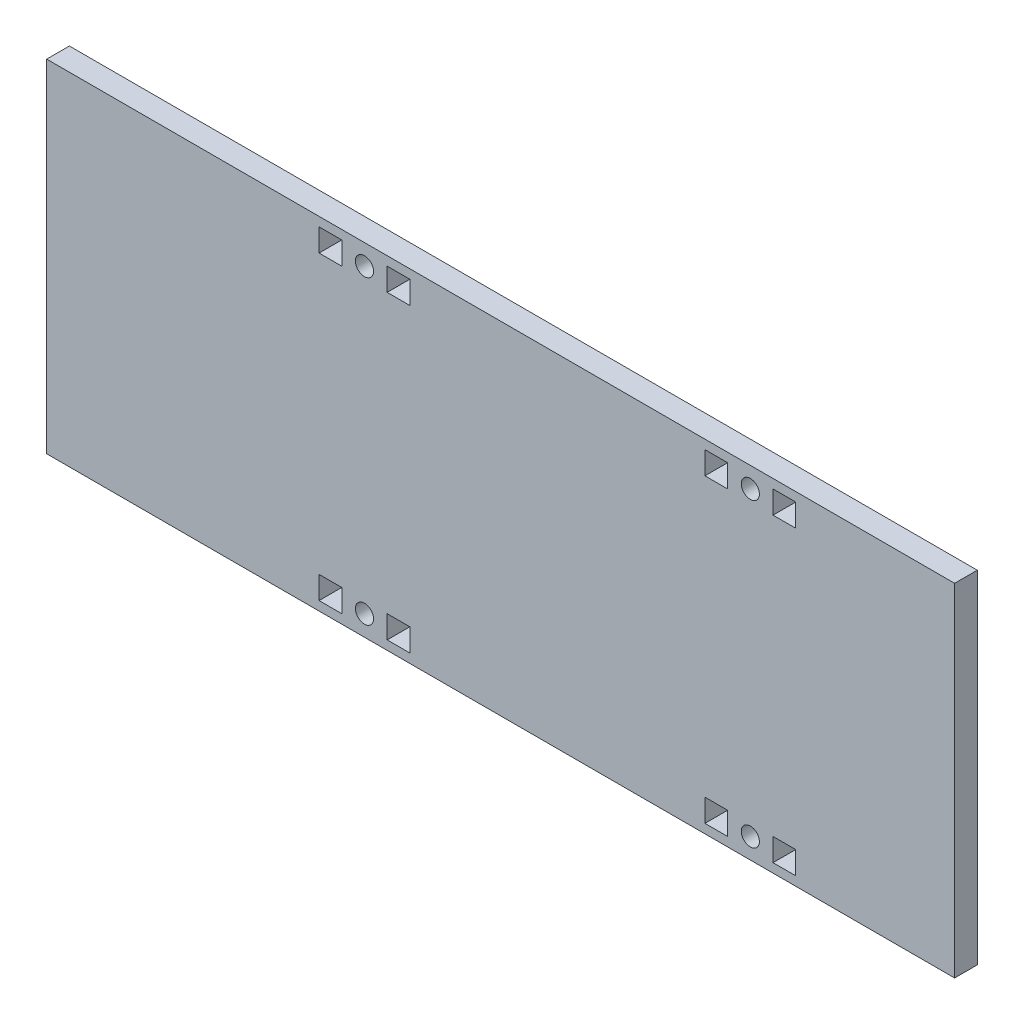
from build123d import *

# Parameters (mm, degrees)
ESQUISSE1_W        = 200
ESQUISSE1_H        = 75.3
ESQUISSE1_R        = 2
ESQUISSE1_W_2      = 5
ESQUISSE1_H_2      = 5
BOSS_EXTRU_1_DEPTH = 5


with BuildPart() as part:
    # Esquisse1 → Boss.-Extru.1 (new body)
    with BuildSketch(Plane.XY):
        with Locations((100, 0)):
            Rectangle(ESQUISSE1_W, ESQUISSE1_H)
        with Locations((70, 33.15)):
            Circle(ESQUISSE1_R, mode=Mode.SUBTRACT)
        with Locations((155, 33.15)):
            Circle(ESQUISSE1_R, mode=Mode.SUBTRACT)
        with Locations((155, -33.15)):
            Circle(ESQUISSE1_R, mode=Mode.SUBTRACT)
        with Locations((70, -33.15)):
            Circle(ESQUISSE1_R, mode=Mode.SUBTRACT)
        with Locations((62.5, 33.15)):
            Rectangle(ESQUISSE1_W_2, ESQUISSE1_H_2, mode=Mode.SUBTRACT)
        with Locations((77.5, 33.15)):
            Rectangle(ESQUISSE1_W_2, ESQUISSE1_H_2, mode=Mode.SUBTRACT)
        with Locations((147.5, 33.15)):
            Rectangle(ESQUISSE1_W_2, ESQUISSE1_H_2, mode=Mode.SUBTRACT)
        with Locations((162.5, 33.15)):
            Rectangle(ESQUISSE1_W_2, ESQUISSE1_H_2, mode=Mode.SUBTRACT)
        with Locations((147.5, -33.15)):
            Rectangle(ESQUISSE1_W_2, ESQUISSE1_H_2, mode=Mode.SUBTRACT)
        with Locations((162.5, -33.15)):
            Rectangle(ESQUISSE1_W_2, ESQUISSE1_H_2, mode=Mode.SUBTRACT)
        with Locations((62.5, -33.15)):
            Rectangle(ESQUISSE1_W_2, ESQUISSE1_H_2, mode=Mode.SUBTRACT)
        with Locations((77.5, -33.15)):
            Rectangle(ESQUISSE1_W_2, ESQUISSE1_H_2, mode=Mode.SUBTRACT)
    extrude(amount=BOSS_EXTRU_1_DEPTH)


solid = part.part
